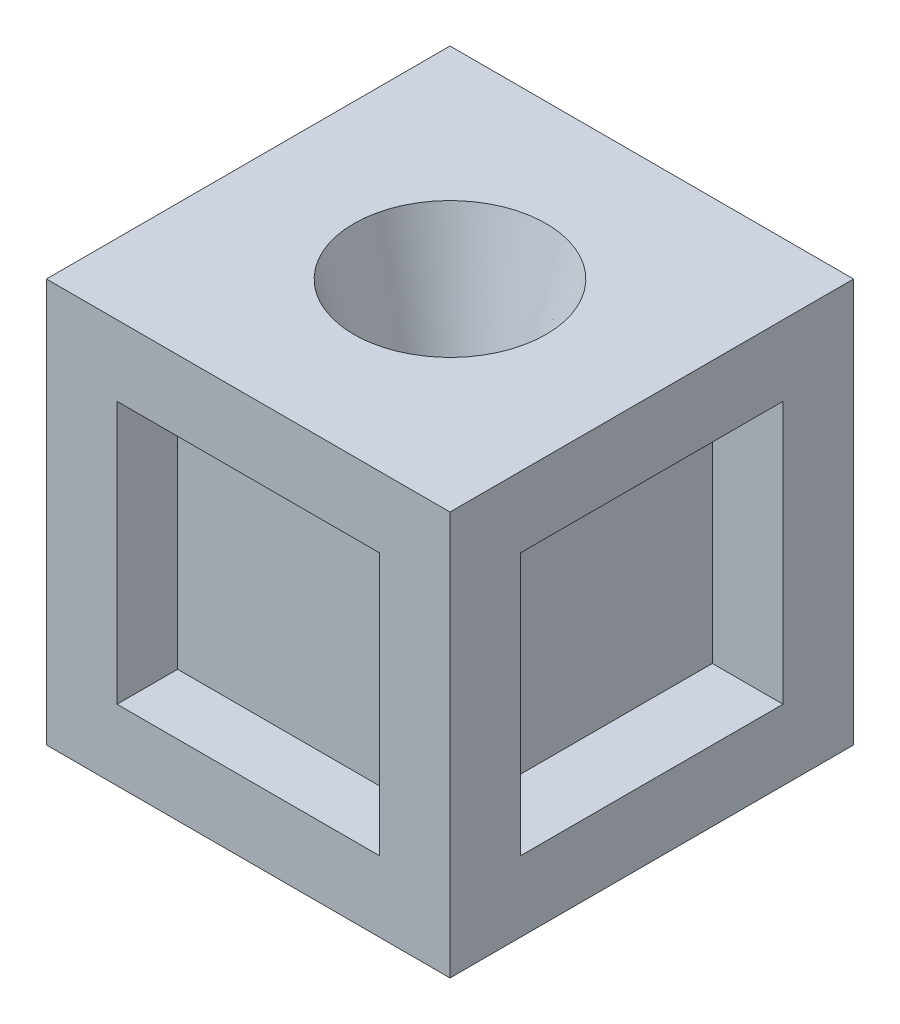
from build123d import *

# Parameters (mm, degrees)
ESBO_O1_W                = 40
ESBO_O1_H                = 40
RESSALTO_EXTRUS_O1_DEPTH = 40
FILETE1_R                = 1
ESBO_O10_W               = 26
ESBO_O10_H               = 26
CORTE_EXTRUS_O3_DEPTH    = 7
ESBO_O11_W               = 26
ESBO_O11_H               = 26
CORTE_EXTRUS_O6_DEPTH    = 6
ESBO_O12_W               = 26
ESBO_O12_H               = 26
CORTE_EXTRUS_O7_DEPTH    = 6
ESBO_O13_W               = 26
ESBO_O13_H               = 26
CORTE_EXTRUS_O8_DEPTH    = 7


with BuildPart() as part:
    # Esboço1 → Ressalto-extrusão1 (new body)
    with BuildSketch(Plane(origin=(0, 0, 0), x_dir=(1, 0, 0), z_dir=(0, 1, 0))):
        with Locations((-13.703200382, -28.10068404)):
            Rectangle(ESBO_O1_W, ESBO_O1_H)
    extrude(amount=RESSALTO_EXTRUS_O1_DEPTH)

    # Loft de corte4: read off the stored shape, not the designer's step
    # Loft de corte4: loft between two sections, ruled curve by curve
    loft_de_corte4_from = [
        Edge.make_bspline([(-11.144198007, 40, 18.927950759), (7.201268555, 40, 24.04595551), (2.083263805, 40, 42.391422072), (-16.262202757, 40, 37.273417321), (-34.607669319, 40, 32.155412571), (-29.489664569, 40, 13.809946009), (-11.144198007, 40, 18.927950759)], [0, 0, 0, 0, 0.5, 0.5, 0.5, 1, 1, 1, 1], 3, [1, 0.333333333, 0.333333333, 1, 0.333333333, 0.333333333, 1]),
    ]
    loft_de_corte4_to = [
        Edge.make_bspline([(-10.380671839, 11.42, 27.000318611), (-8.179940979, 11.42, 33.645375697), (-14.824998066, 11.42, 35.846106557), (-17.025728925, 11.42, 29.20104947), (-19.226459785, 11.42, 22.555992384), (-12.581402699, 11.42, 20.355261524), (-10.380671839, 11.42, 27.000318611)], [0, 0, 0, 0, 0.5, 0.5, 0.5, 1, 1, 1, 1], 3, [1, 0.333333333, 0.333333333, 1, 0.333333333, 0.333333333, 1]),
    ]
    loft_de_corte4 = Solid(Shell([*[Face.make_surface_from_curves(loft_de_corte4_from[k], loft_de_corte4_to[k]) for k in range(1)], Face(Wire(loft_de_corte4_from)), Face(Wire(loft_de_corte4_to))]))
    add(loft_de_corte4, mode=Mode.SUBTRACT)

    # Filete1
    filete1_edges = [part.edges().sort_by_distance(p)[0] for p in [
        (-17.025728925, 11.42, 29.20104947),
    ]]
    fillet(filete1_edges, radius=FILETE1_R)

    # Esboço10 → Corte-extrusão3 (cut)
    with BuildSketch(Plane.ZY.offset(33.703200382)):
        with Locations((28.10068404, 20)):
            Rectangle(ESBO_O10_W, ESBO_O10_H)
    extrude(amount=-CORTE_EXTRUS_O3_DEPTH, mode=Mode.SUBTRACT)

    # Esboço11 → Corte-extrusão6 (cut)
    with BuildSketch(Plane(origin=(0, 0, 8.10068404), x_dir=(-1, 0, 0), z_dir=(0, 0, -1))):
        with Locations((13.703200382, 20)):
            Rectangle(ESBO_O11_W, ESBO_O11_H)
    extrude(amount=-CORTE_EXTRUS_O6_DEPTH, mode=Mode.SUBTRACT)

    # Esboço12 → Corte-extrusão7 (cut)
    with BuildSketch(Plane.XY.offset(48.10068404)):
        with Locations((-13.703200382, 20)):
            Rectangle(ESBO_O12_W, ESBO_O12_H)
    extrude(amount=-CORTE_EXTRUS_O7_DEPTH, mode=Mode.SUBTRACT)

    # Esboço13 → Corte-extrusão8 (cut)
    with BuildSketch(Plane(origin=(6.296799618, 0, 0), x_dir=(0, 0, -1), z_dir=(1, 0, 0))):
        with Locations((-28.10068404, 20)):
            Rectangle(ESBO_O13_W, ESBO_O13_H)
    extrude(amount=-CORTE_EXTRUS_O8_DEPTH, mode=Mode.SUBTRACT)


solid = part.part
